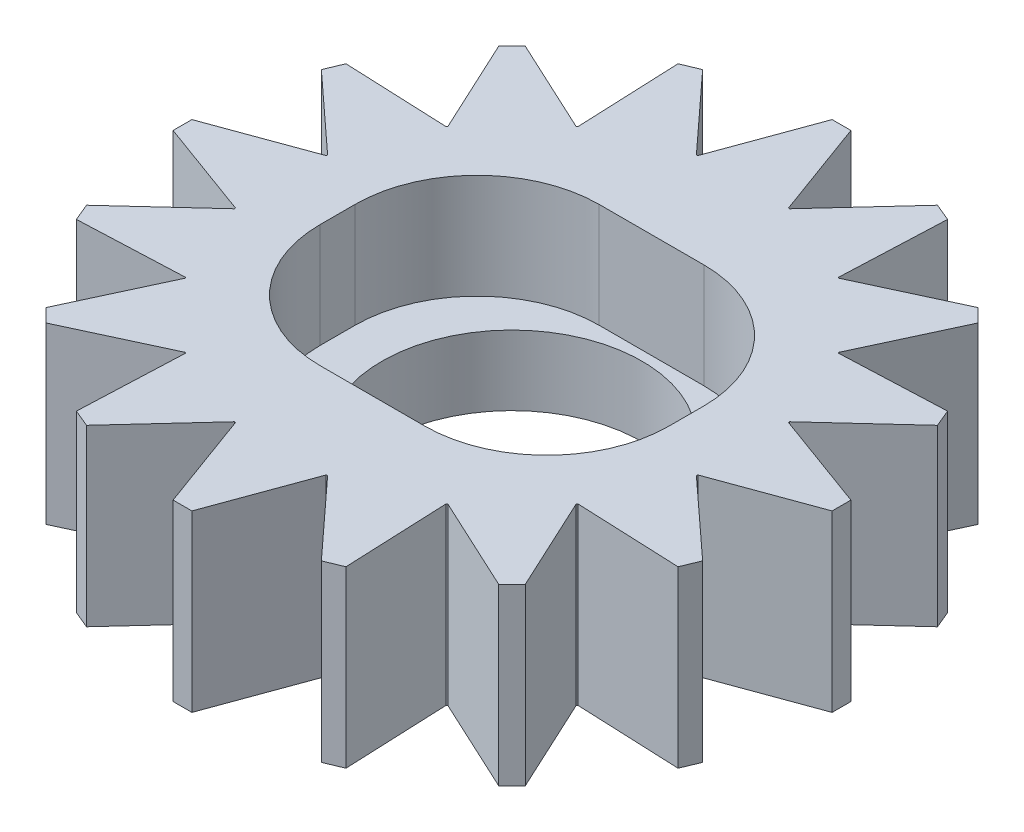
from build123d import *

# Parameters (mm, degrees)
SKETCH2_R           = 6.75
BOSS_EXTRUDE1_DEPTH = 5
SKETCH3_W           = 10
SKETCH3_H           = 8
CUT_EXTRUDE1_DEPTH  = 3
FILLET1_R           = 3.5
SKETCH4_R           = 3.725
CUT_EXTRUDE2_DEPTH  = 11.006248048
BOSS_EXTRUDE2_DEPTH = 5
CIRPATTERN1_COUNT   = 16


with BuildPart() as part:
    # Sketch2 → Boss-Extrude1 (new body)
    with BuildSketch(Plane(origin=(0, 0, 0), x_dir=(1, 0, 0), z_dir=(0, 1, 0))):
        Circle(SKETCH2_R)
    extrude(amount=BOSS_EXTRUDE1_DEPTH)

    # Sketch3 → Cut-Extrude1 (cut)
    with BuildSketch(Plane(origin=(0, 5, 0), x_dir=(1, 0, 0), z_dir=(0, 1, 0))):
        Rectangle(SKETCH3_W, SKETCH3_H)
    extrude(amount=-CUT_EXTRUDE1_DEPTH, mode=Mode.SUBTRACT)

    # Fillet1
    fillet1_edges = [part.edges().sort_by_distance(p)[0] for p in [
        (-5, 3.5, 4),
        (5, 3.5, 4),
        (-5, 3.5, -4),
        (5, 3.5, -4),
    ]]
    fillet(fillet1_edges, radius=FILLET1_R)

    # Sketch4 → Cut-Extrude2 (cut, through all)
    with BuildSketch(Plane(origin=(0, 2, 0), x_dir=(1, 0, 0), z_dir=(0, 1, 0))):
        Circle(SKETCH4_R)
    extrude(amount=-CUT_EXTRUDE2_DEPTH, mode=Mode.SUBTRACT)

    # Sketch5 → Boss-Extrude2 (add)
    with BuildSketch(Plane(origin=(0, 5, 0), x_dir=(1, 0, 0), z_dir=(0, 1, 0))):
        Polygon((-1.300127145, 6.623606979), (-0.269661895, 9.441952037), (0.269661895, 9.441952037), (1.300127145, 6.623606979), align=None)
        Polygon((-0.269661895, -9.441952037), (-1.300127145, -6.623606979), (1.300127145, -6.623606979), (0.269661895, -9.441952037), align=None)
    boss_extrude2 = extrude(amount=-BOSS_EXTRUDE2_DEPTH)

    # CirPattern1: Boss-Extrude2 ×16 about axis
    cirpattern1_axis = Axis((0, 2, 0), (0, 1, 0))
    for i in range(1, CIRPATTERN1_COUNT):
        add(boss_extrude2.rotate(cirpattern1_axis, i * 360 / CIRPATTERN1_COUNT))


solid = part.part
